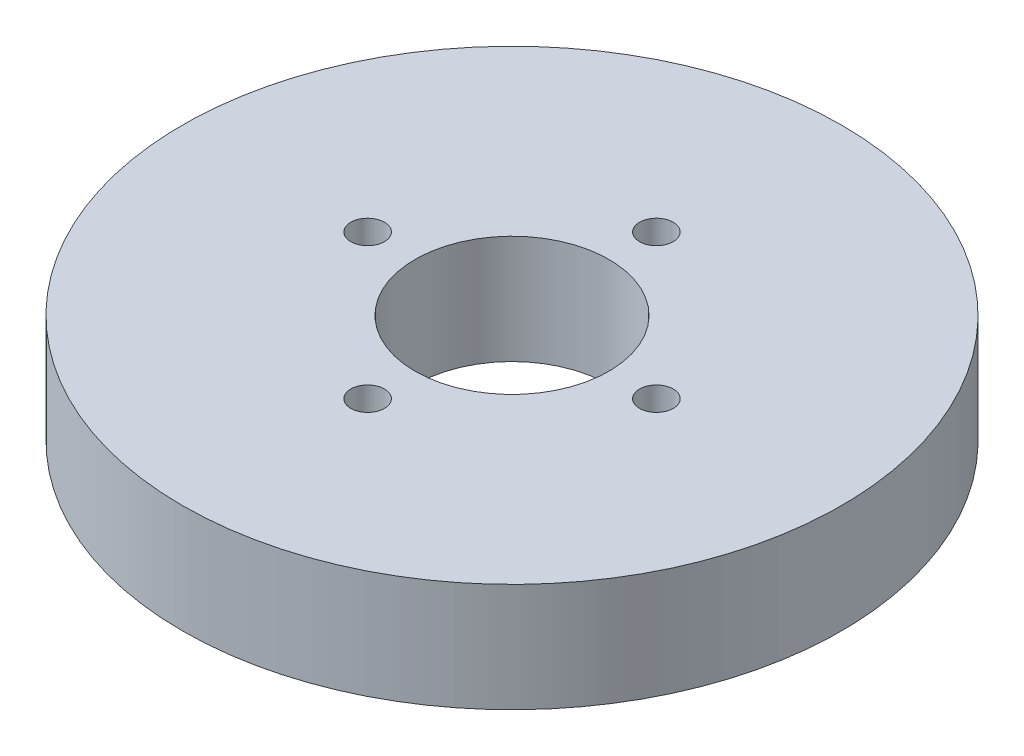
from build123d import *

# Parameters (mm, degrees)
SKETCH1_R           = 42.5
BOSS_EXTRUDE1_DEPTH = 14
SKETCH2_R           = 12.5
CUT_EXTRUDE1_DEPTH  = 62.713045622
SKETCH3_R           = 2.173069289
CUT_EXTRUDE2_DEPTH  = 9.278215114
CIRPATTERN1_COUNT   = 4


with BuildPart() as part:
    # Sketch1 → Boss-Extrude1 (new body)
    with BuildSketch(Plane(origin=(0, 0, 0), x_dir=(1, 0, 0), z_dir=(0, 1, 0))):
        Circle(SKETCH1_R)
    extrude(amount=BOSS_EXTRUDE1_DEPTH)

    # Sketch2 → Cut-Extrude1 (cut, through all)
    with BuildSketch(Plane(origin=(0, 0, 0), x_dir=(1, 0, 0), z_dir=(0, 1, 0))):
        Circle(SKETCH2_R)
    extrude(amount=CUT_EXTRUDE1_DEPTH, mode=Mode.SUBTRACT)

    # Sketch3 → Cut-Extrude2 (cut)
    with BuildSketch(Plane(origin=(0, 14, 0), x_dir=(1, 0, 0), z_dir=(0, 1, 0))):
        with Locations((-18.619536516, 0)):
            Circle(SKETCH3_R)
    cut_extrude2 = extrude(amount=-CUT_EXTRUDE2_DEPTH, mode=Mode.SUBTRACT)

    # CirPattern1: Cut-Extrude2 ×4 about axis
    cirpattern1_axis = Axis((0, 0, 0), (0, 1, 0))
    for i in range(1, CIRPATTERN1_COUNT):
        add(cut_extrude2.rotate(cirpattern1_axis, i * 360 / CIRPATTERN1_COUNT), mode=Mode.SUBTRACT)


solid = part.part
